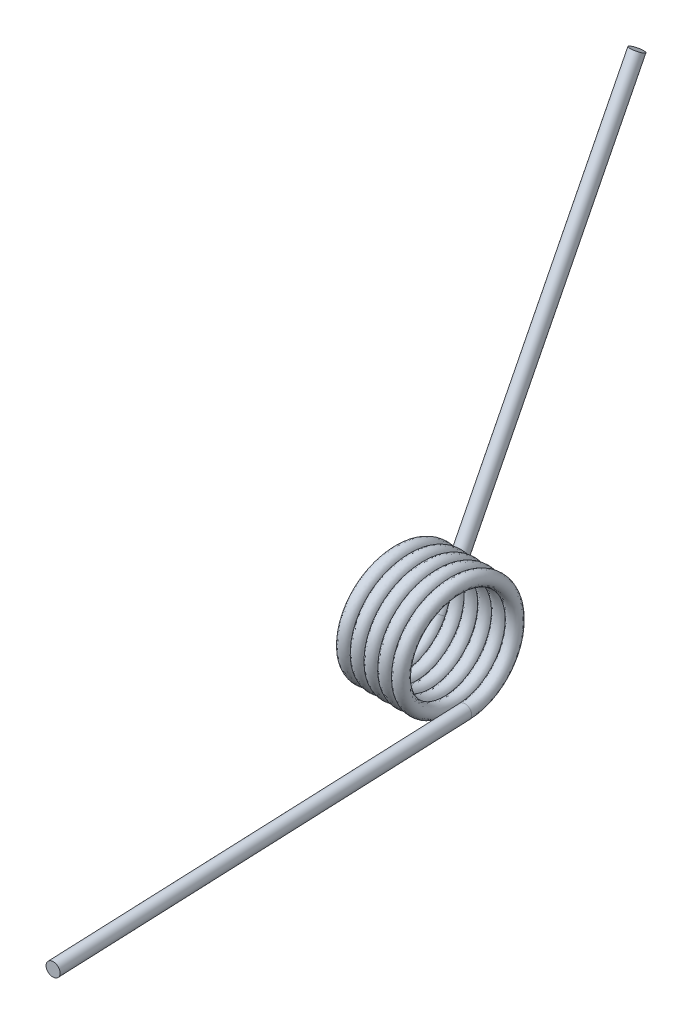
from build123d import *

# Parameters (mm, degrees)
SWEEP1_PITCH   = 1.6256
SKETCH4_R      = 0.8001
EXTRUDE1_DEPTH = 50.8
SKETCH5_R      = 0.8001
EXTRUDE2_DEPTH = 50.8


with BuildPart() as part:
    # Sweep1: arcs per turn and ends read off the stored shape
    # Sweep1: the profile of Sketch3 screwed along a left-hand helix through 5.166667 turns, 6 arcs to a turn; built about Z, then put on its axis
    sweep1_z = Axis((0, 0, 0), (0, 0, 1))
    sweep1_corners = [(6.330491227, -0.032759418, -0.799212861), (7.111783977, 0.000761408, 0.018575629), (6.293308773, 0.032759418, 0.799212861), (5.512016023, -0.000761408, -0.018575629)]
    with BuildLine(mode=Mode.PRIVATE) as sweep1_profile:
        ThreePointArc((6.330491227, -0.032759418, -0.799212861), (6.890649367, -0.02262601, -0.551993881), (7.111783977, 0.000761408, 0.018575629))
        ThreePointArc((7.111783977, 0.000761408, 0.018575629), (6.864357402, 0.023702803, 0.578263786), (6.293308773, 0.032759418, 0.799212861))
        ThreePointArc((6.293308773, 0.032759418, 0.799212861), (5.733150633, 0.02262601, 0.551993881), (5.512016023, -0.000761408, -0.018575629))
        ThreePointArc((5.512016023, -0.000761408, -0.018575629), (5.759442598, -0.023702803, -0.578263786), (6.330491227, -0.032759418, -0.799212861))
    sweep1_cap = Face(sweep1_profile.wire())
    sweep1_arcs = [((6.330491227, -0.032759418, -0.799212861), (7.130375204, -0.03199801, -0.780637232), (7.111783977, 0.000761408, 0.018575629), (1, 0.7071067811865476, 1)), ((7.111783977, 0.000761408, 0.018575629), (7.09319275, 0.033520826, 0.817788489), (6.293308773, 0.032759418, 0.799212861), (1, 0.7071067811865476, 1)), ((6.293308773, 0.032759418, 0.799212861), (5.493424796, 0.03199801, 0.780637232), (5.512016023, -0.000761408, -0.018575629), (1, 0.7071067811865476, 1)), ((5.512016023, -0.000761408, -0.018575629), (5.53060725, -0.033520826, -0.817788489), (6.330491227, -0.032759418, -0.799212861), (1, 0.7071067811865476, 1))]  # start, shoulder, end, weights
    sweep1_turn_angles = [0, -30, -60, -90, -120, -150, -180, -210, -240, -270, -300, -330, -360]
    sweep1_turn_weights = [1, 0.8660254037844387, 1, 0.8660254037844387, 1, 0.8660254037844387, 1, 0.8660254037844387, 1, 0.8660254037844387, 1, 0.8660254037844387, 1]
    sweep1_turn_sides = [Face.make_bezier_surface([[Vector(p[j][0], p[j][1], 0).rotate(sweep1_z, sweep1_turn_angles[2 * i + k]) / sweep1_turn_weights[2 * i + k] + Vector(0, 0, p[j][2] + -SWEEP1_PITCH * sweep1_turn_angles[2 * i + k] / 360) for k in range(3)] for j in range(3)], [[p[3][j] * sweep1_turn_weights[2 * i + k] for k in range(3)] for j in range(3)]) for p in sweep1_arcs for i in range(6)]
    sweep1_last_angles = [-1800, -1830, -1860]
    sweep1_last_weights = [1, 0.8660254037844158, 1]
    sweep1_last_sides = [Face.make_bezier_surface([[Vector(p[j][0], p[j][1], 0).rotate(sweep1_z, sweep1_last_angles[2 * i + k]) / sweep1_last_weights[2 * i + k] + Vector(0, 0, p[j][2] + -SWEEP1_PITCH * sweep1_last_angles[2 * i + k] / 360) for k in range(3)] for j in range(3)], [[p[3][j] * sweep1_last_weights[2 * i + k] for k in range(3)] for j in range(3)]) for p in sweep1_arcs for i in range(1)]
    sweep1 = Plane(origin=(0, 0, 0), x_dir=(0, -1, 0), z_dir=(-1, 0, 0)) * Solid(Shell([*[p.moved(Location((0, 0, SWEEP1_PITCH * i))) for i in range(5) for p in sweep1_turn_sides], *sweep1_last_sides, sweep1_cap, sweep1_cap.rotate(sweep1_z, -1860).moved(Location((0, 0, -SWEEP1_PITCH * -1860 / 360)))]))
    add(sweep1)

    # Sketch4 → Extrude1 (add)
    with BuildSketch(Plane(origin=(0, 0, 0), x_dir=(-0.9988912145610835, 0.02323612909274781, 0.040944154374815696), z_dir=(0.04095521208944008, -1.1519539662441236e-14, 0.9991609833268658))):
        with Locations(Location((-0.146664123, 6.310195817, 0), (0, 0, 1.33145196))):
            Circle(SKETCH4_R)
    extrude(amount=EXTRUDE1_DEPTH)

    # Sketch5 → Extrude2 (add)
    with BuildSketch(Plane(origin=(-0.014087778, 0.297645562, -0.171845745), x_dir=(0.9991609827879865, 0.035484675571451844, -0.02044916315485051), z_dir=(-0.040955212089440085, 0.8652987940313562, -0.49958049166334506))):
        with Locations(Location((-8.392093785, 6.311624382, 0), (0, 0, 180.001881766))):
            Circle(SKETCH5_R)
    extrude(amount=EXTRUDE2_DEPTH)


solid = part.part
